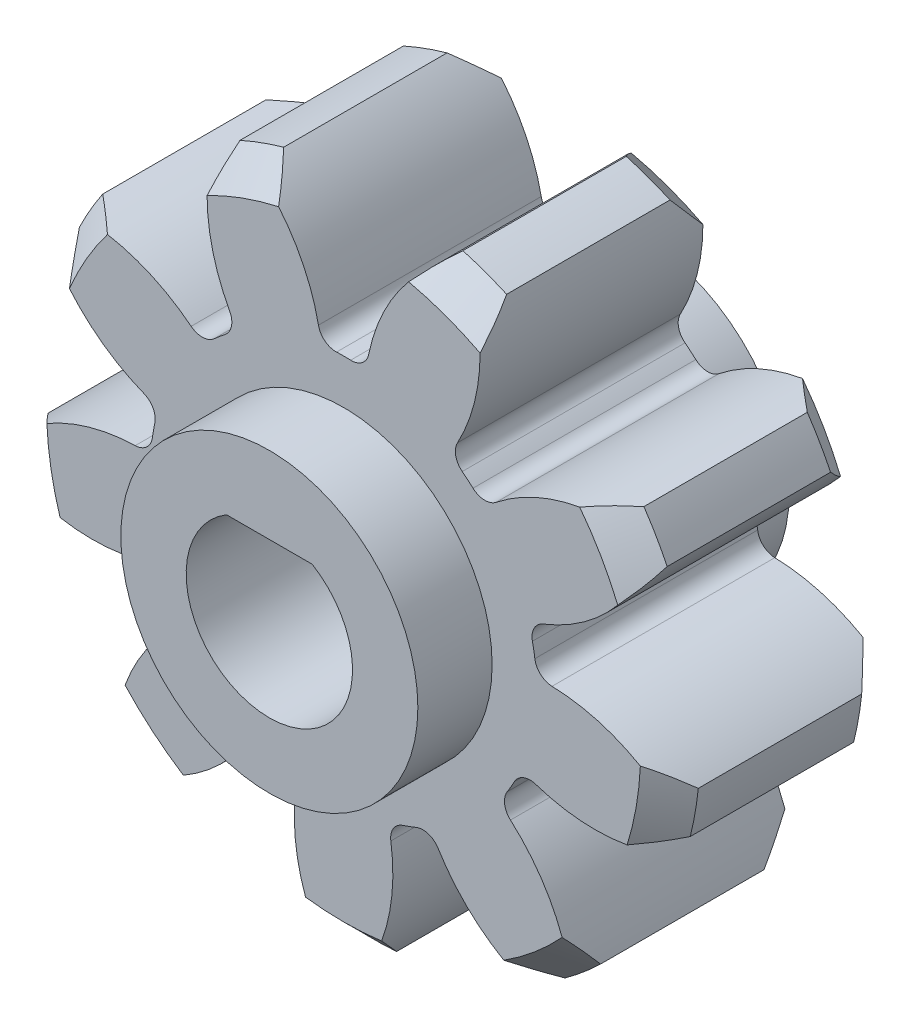
from build123d import *

# Parameters (mm, degrees)
SKICA1_R                     = 11
P_IDAT_VYSUNUT_M1_DEPTH      = 7.5
ODEBRAT_VYSUNUT_M1_DEPTH     = 7.5
ZAOBLIT1_R                   = 0.6
ZKOSEN_1_SIZE                = 1
KRUHOV_POLE1_COUNT           = 9
ZAOBLIT1_OF_KRUHOV_POLE1_R   = 0.6
P_IDAT_VYSUNUT_M2_DEPTH      = 10
P_IDAT_VYSUNUT_M2_DEPTH_BACK = 2.5
SKICA3_R                     = 5
ODEBRAT_VYSUNUT_M2_DEPTH     = 20


with BuildPart() as part:
    # Skica1 → Přidat vysunutím1 (new body)
    with BuildSketch(Plane.XY):
        Circle(SKICA1_R)
    extrude(amount=P_IDAT_VYSUNUT_M1_DEPTH)

    # Skica2 → Odebrat vysunutím1 (cut)
    with BuildSketch(Plane.XY):
        with BuildLine():
            ThreePointArc((-3.016647194, 10.578272057), (-1.490675718, 8.734840985), (-0.763082007, 6.455052738))
            ThreePointArc((-0.763082007, 6.455052738), (0, 6.5), (0.763082007, 6.455052738))
            ThreePointArc((0.763082007, 6.455052738), (1.490675718, 8.734840985), (3.016647194, 10.578272057))
            ThreePointArc((3.016647194, 10.578272057), (0, 11), (-3.016647194, 10.578272057))
        make_face()
    odebrat_vysunut_m1 = extrude(amount=ODEBRAT_VYSUNUT_M1_DEPTH, mode=Mode.SUBTRACT)

    # Zaoblit1
    zaoblit1_edges = [part.edges().sort_by_distance(p)[0] for p in [
        (0.763082007, 6.455052738, 3.75),
        (-0.763082007, 6.455052738, 3.75),
    ]]
    fillet(zaoblit1_edges, radius=ZAOBLIT1_R)

    # Zkosení1
    zkosen_1_edges = [part.edges().sort_by_distance(p)[0] for p in [
        (0, -11, 0),
        (0, -11, 7.5),
    ]]
    chamfer(zkosen_1_edges, length=ZKOSEN_1_SIZE)

    # Kruhové pole1: Odebrat vysunutím1 ×9 about axis
    kruhov_pole1_axis = Axis((0, 0, 7.5), (0, 0, -1))
    for i in range(1, KRUHOV_POLE1_COUNT):
        add(odebrat_vysunut_m1.rotate(kruhov_pole1_axis, i * 360 / KRUHOV_POLE1_COUNT), mode=Mode.SUBTRACT)

    # Zaoblit1 of Kruhové pole1
    zaoblit1_of_kruhov_pole1_edges = [part.edges().sort_by_distance(p)[0] for p in [
        (4.733782651, 4.45435762, 3.75),
        (3.564673188, 5.435356939, 3.75),
        (6.489493782, 0.369419068, 3.75),
        (6.224478182, 1.872397222, 3.75),
        (5.20869865, -3.888374773, 3.75),
        (5.971780658, -2.566677965, 3.75),
        (1.490695531, -6.326754842, 3.75),
        (2.924820594, -5.804776007, 3.75),
        (-2.924820594, -5.804776007, 3.75),
        (-1.490695531, -6.326754842, 3.75),
        (-5.971780658, -2.566677965, 3.75),
        (-5.20869865, -3.888374773, 3.75),
        (-6.224478182, 1.872397222, 3.75),
        (-6.489493782, 0.369419068, 3.75),
        (-3.564673188, 5.435356939, 3.75),
        (-4.733782651, 4.45435762, 3.75),
    ]]
    fillet(zaoblit1_of_kruhov_pole1_edges, radius=ZAOBLIT1_OF_KRUHOV_POLE1_R)

    # Skica3 → Přidat vysunutím2 (add, two sides: drawn at the far end of the back side and taken through both)
    with BuildSketch(Plane.XY.offset(-P_IDAT_VYSUNUT_M2_DEPTH_BACK)):
        Circle(SKICA3_R)
    extrude(amount=P_IDAT_VYSUNUT_M2_DEPTH + P_IDAT_VYSUNUT_M2_DEPTH_BACK)

    # Skica5 → Odebrat vysunutím2 (cut)
    with BuildSketch(Plane.XY.offset(10)):
        with BuildLine():
            Line((-1.44222051, 2.4), (1.44222051, 2.4))
            ThreePointArc((1.44222051, 2.4), (0, -2.8), (-1.44222051, 2.4))
        make_face()
    extrude(amount=-ODEBRAT_VYSUNUT_M2_DEPTH, mode=Mode.SUBTRACT)


solid = part.part
